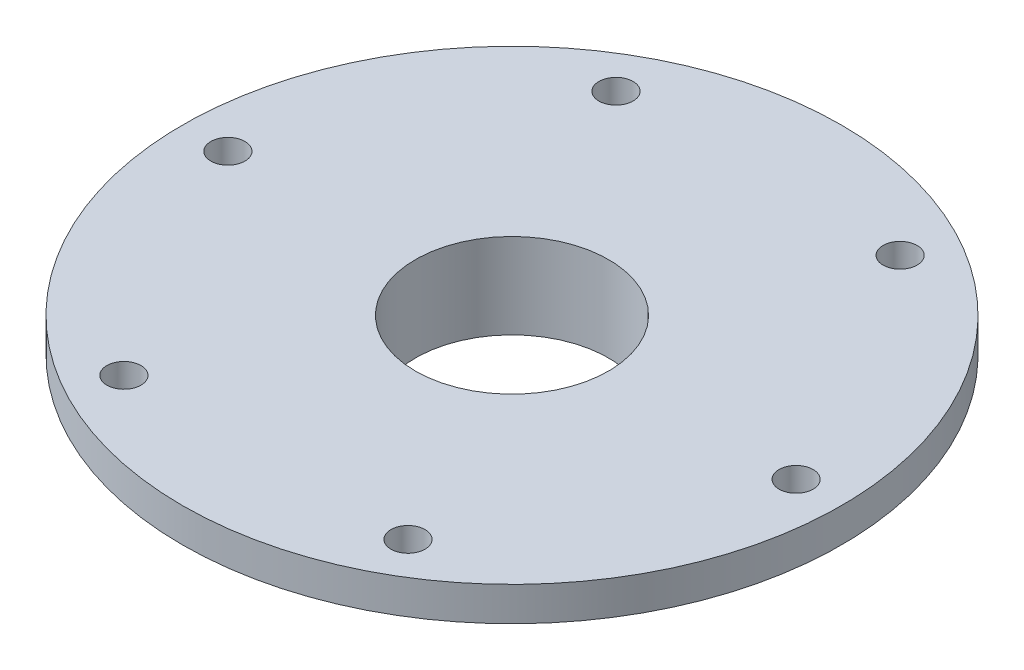
from build123d import *

# Parameters (mm, degrees)
SKETCH5_R          = 1.5
CUT_EXTRUDE1_DEPTH = 42.692325433


with BuildPart() as part:
    # Sketch4 → Revolve1 (revolve)
    with BuildSketch(Plane.XY):
        Polygon((-8.5, 0), (-29, 0), (-29, -3), (-11.75, -3), (-11.75, -7.5), (-8.5, -7.5), align=None)
    revolve(axis=Axis((0, 27.279243053, 0), (0, -1, 0)))

    # Sketch5 → Cut-Extrude1 (cut, through all)
    with BuildSketch(Plane(origin=(0, 0, 0), x_dir=(1, 0, 0), z_dir=(0, 1, 0))):
        with Locations((-25, 0)):
            Circle(SKETCH5_R)
        with Locations((-12.5, 21.650635095)):
            Circle(SKETCH5_R)
        with Locations((12.5, 21.650635095)):
            Circle(SKETCH5_R)
        with Locations((25, 0)):
            Circle(SKETCH5_R)
        with Locations((12.5, -21.650635095)):
            Circle(SKETCH5_R)
        with Locations((-12.5, -21.650635095)):
            Circle(SKETCH5_R)
    extrude(amount=-CUT_EXTRUDE1_DEPTH, mode=Mode.SUBTRACT)


solid = part.part
